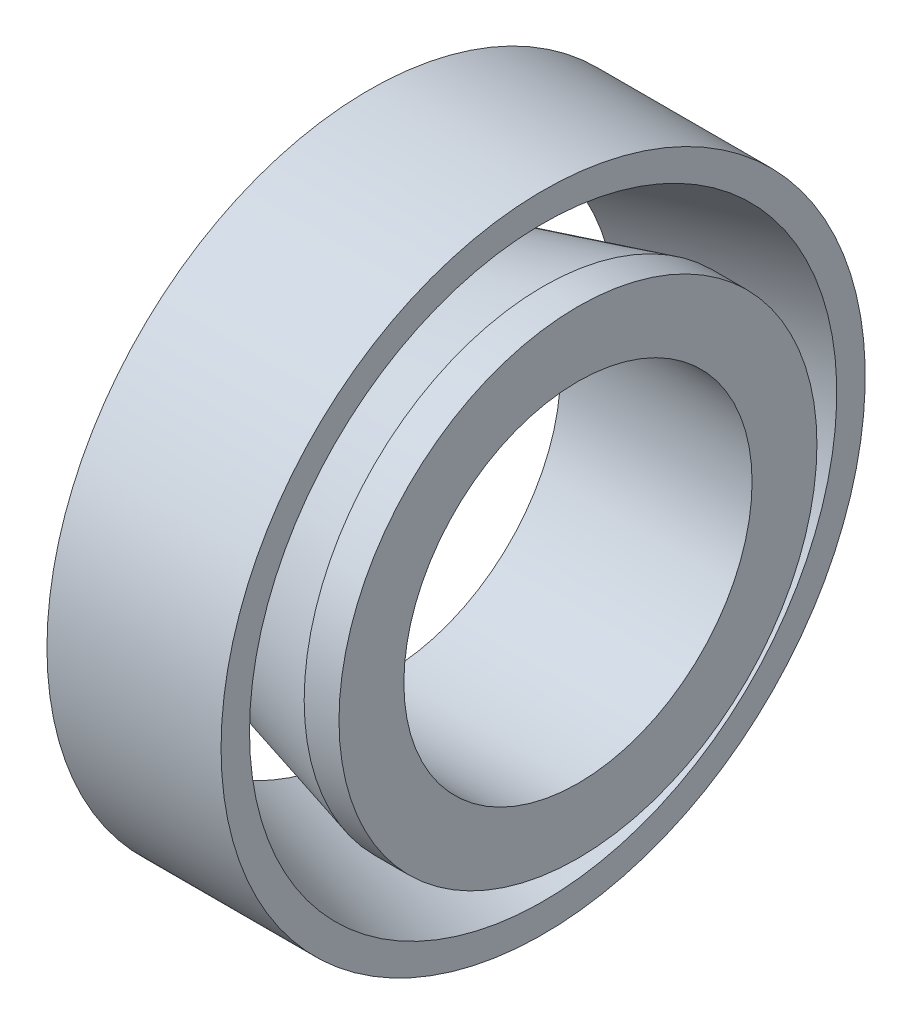
from build123d import *


with BuildPart() as part:
    # 草图3 → 旋转1 (revolve)
    with BuildSketch(Plane.XY):
        Polygon((0, 18.5), (10, 18.5), (10, 16.865646139), (0, 14.186154215), align=None)
        Polygon((1, 10), (12, 10), (12, 13.725747662), (10, 13.725747662), (1, 11.31420493), align=None)
    revolve(axis=Axis((0, 0, 0), (1, 0, 0)))


solid = part.part
